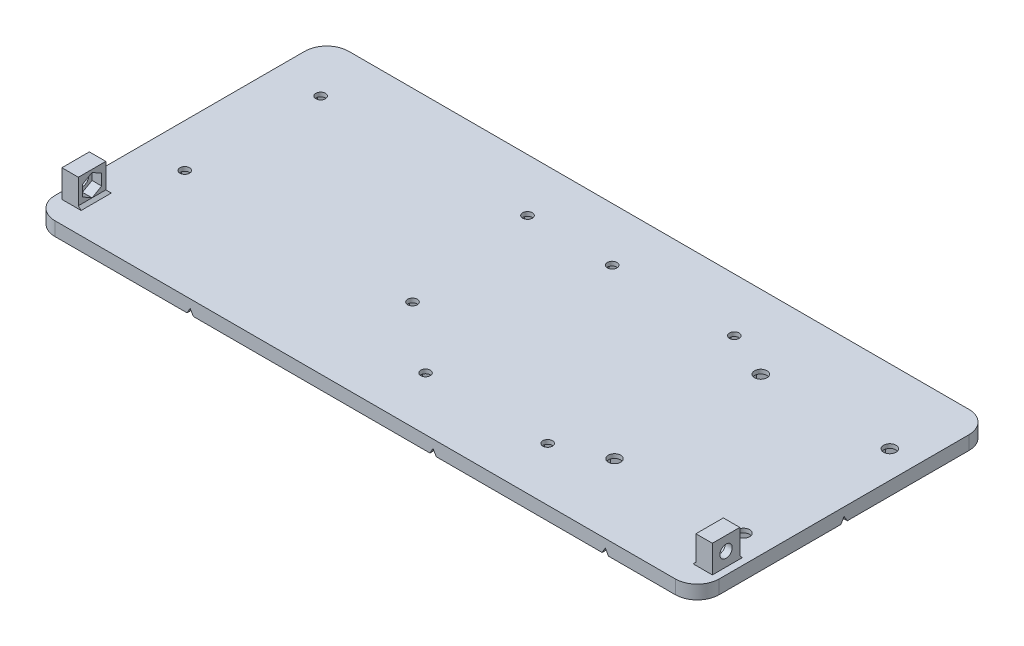
from build123d import *

# Parameters (mm, degrees)
SKETCH3_W               = 242.01
SKETCH3_H               = 107
SKETCH3_R               = 1.75
SKETCH3_R_2             = 2.25
BOSS_EXTRUDE3_DEPTH     = 5
CUT_EXTRUDE1_DEPTH      = 3.5
SKETCH7_W               = 10
SKETCH7_H               = 10
SKETCH7_R               = 2.25
BOSS_EXTRUDE4_DEPTH     = 6
CUT_EXTRUDE2_DEPTH      = 3.5
FILLET1_R               = 8
SKETCH9_W               = 29.32110464
SKETCH9_H               = 129.190564079
CUT_EXTRUDE3_DEPTH      = 10
SKETCH10_W              = 10
SKETCH10_H              = 10
SKETCH10_R              = 2.25
BOSS_EXTRUDE5_DEPTH     = 6
CUT_EXTRUDE4_DEPTH      = 3.5
CUT_EXTRUDE5_DEPTH      = 188.925883263
CUT_EXTRUDE5_DEPTH_BACK = 188.925883263
CUT_EXTRUDE6_DEPTH      = 249.306443936
CUT_EXTRUDE6_DEPTH_BACK = 249.306443936
CHAMFER1_SIZE           = 1


with BuildPart() as part:
    # Sketch3 → Boss-Extrude3 (new body)
    with BuildSketch(Plane(origin=(0, 0, 0), x_dir=(1, 0, 0), z_dir=(0, 1, 0))):
        with Locations((32.755, 0)):
            Rectangle(SKETCH3_W, SKETCH3_H)
        with Locations(Location((-72.5, -14, 0), (0, 0, 270))):
            Circle(SKETCH3_R, mode=Mode.SUBTRACT)
        with Locations(Location((10.5, -14, 0), (0, 0, 270))):
            Circle(SKETCH3_R, mode=Mode.SUBTRACT)
        with Locations(Location((96.75, -26.655, 0), (0, 0, 270))):
            Circle(SKETCH3_R_2, mode=Mode.SUBTRACT)
        with Locations(Location((96.75, 26.655, 0), (0, 0, 270))):
            Circle(SKETCH3_R_2, mode=Mode.SUBTRACT)
        with Locations(Location((143.76, 26.655, 0), (0, 0, 270))):
            Circle(SKETCH3_R_2, mode=Mode.SUBTRACT)
        with Locations(Location((143.76, -26.655, 0), (0, 0, 270))):
            Circle(SKETCH3_R_2, mode=Mode.SUBTRACT)
        with Locations(Location((35.25, 34, 0), (0, 0, 270))):
            Circle(SKETCH3_R, mode=Mode.SUBTRACT)
        with Locations(Location((79.75, 34, 0), (0, 0, 270))):
            Circle(SKETCH3_R, mode=Mode.SUBTRACT)
        with Locations(Location((35.25, -34, 0), (0, 0, 270))):
            Circle(SKETCH3_R, mode=Mode.SUBTRACT)
        with Locations(Location((79.75, -34, 0), (0, 0, 270))):
            Circle(SKETCH3_R, mode=Mode.SUBTRACT)
        with Locations(Location((-71.23, 34.26, 0), (0, 0, 270))):
            Circle(SKETCH3_R, mode=Mode.SUBTRACT)
        with Locations(Location((4.15, 34.26, 0), (0, 0, 270))):
            Circle(SKETCH3_R, mode=Mode.SUBTRACT)
    extrude(amount=BOSS_EXTRUDE3_DEPTH)

    # Sketch4 → Cut-Extrude1 (cut)
    with BuildSketch(Plane.XZ):
        Polygon((96.75, 30.696451884), (93.25, 28.675725942), (93.25, 24.634274058), (96.75, 22.613548116), (100.25, 24.634274058), (100.25, 28.675725942), align=None)
        Polygon((143.76, 30.696451884), (140.26, 28.675725942), (140.26, 24.634274058), (143.76, 22.613548116), (147.26, 24.634274058), (147.26, 28.675725942), align=None)
        Polygon((96.75, -22.613548116), (93.25, -24.634274058), (93.25, -28.675725942), (96.75, -30.696451884), (100.25, -28.675725942), (100.25, -24.634274058), align=None)
        Polygon((143.76, -30.696451884), (147.26, -28.675725942), (147.26, -24.634274058), (143.76, -22.613548116), (140.26, -24.634274058), (140.26, -28.675725942), align=None)
        Polygon((-72.5, 17.117691454), (-75.2, 15.558845727), (-75.2, 12.441154273), (-72.5, 10.882308546), (-69.8, 12.441154273), (-69.8, 15.558845727), align=None)
        Polygon((10.5, 17.117691454), (7.8, 15.558845727), (7.8, 12.441154273), (10.5, 10.882308546), (13.2, 12.441154273), (13.2, 15.558845727), align=None)
        Polygon((35.25, 37.117691454), (32.55, 35.558845727), (32.55, 32.441154273), (35.25, 30.882308546), (37.95, 32.441154273), (37.95, 35.558845727), align=None)
        Polygon((79.75, 37.117691454), (77.05, 35.558845727), (77.05, 32.441154273), (79.75, 30.882308546), (82.45, 32.441154273), (82.45, 35.558845727), align=None)
        Polygon((79.75, -30.882308546), (77.05, -32.441154273), (77.05, -35.558845727), (79.75, -37.117691454), (82.45, -35.558845727), (82.45, -32.441154273), align=None)
        Polygon((35.25, -30.882308546), (32.55, -32.441154273), (32.55, -35.558845727), (35.25, -37.117691454), (37.95, -35.558845727), (37.95, -32.441154273), align=None)
        Polygon((-71.23, -31.142308546), (-73.93, -32.701154273), (-73.93, -35.818845727), (-71.23, -37.377691454), (-68.53, -35.818845727), (-68.53, -32.701154273), align=None)
        Polygon((4.15, -31.142308546), (1.45, -32.701154273), (1.45, -35.818845727), (4.15, -37.377691454), (6.85, -35.818845727), (6.85, -32.701154273), align=None)
    extrude(amount=-CUT_EXTRUDE1_DEPTH, mode=Mode.SUBTRACT)

    # Sketch7 → Boss-Extrude4 (add)
    with BuildSketch(Plane.XY.offset(51)):
        with Locations((58, 10)):
            Rectangle(SKETCH7_W, SKETCH7_H)
        with Locations((58, 10)):
            Circle(SKETCH7_R, mode=Mode.SUBTRACT)
    boss_extrude4 = extrude(amount=-BOSS_EXTRUDE4_DEPTH)

    # Sketch8 → Cut-Extrude2 (cut)
    with BuildSketch(Plane(origin=(0, 0, 45), x_dir=(-1, 0, 0), z_dir=(0, 0, -1))):
        Polygon((-58, 14.012584371), (-61.475, 12.006292185), (-61.475, 7.993707815), (-58, 5.987415629), (-54.525, 7.993707815), (-54.525, 12.006292185), align=None)
    cut_extrude2 = extrude(amount=-CUT_EXTRUDE2_DEPTH, mode=Mode.SUBTRACT)

    # Mirror1: Boss-Extrude4, Cut-Extrude2 across plane
    add(boss_extrude4.mirror(Plane.XY))
    add(cut_extrude2.mirror(Plane.XY), mode=Mode.SUBTRACT)

    # Fillet1
    fillet1_edges = [part.edges().sort_by_distance(p)[0] for p in [
        (-88.25, 2.5, 53.5),
        (-88.25, 2.5, -53.5),
        (153.76, 2.5, -53.5),
        (153.76, 2.5, 53.5),
    ]]
    fillet(fillet1_edges, radius=FILLET1_R)

    # Sketch9 → Cut-Extrude3 (cut)
    with BuildSketch(Plane(origin=(0, 5, 0), x_dir=(1, 0, 0), z_dir=(0, 1, 0))):
        with Locations((53.635180577, -6.372276825)):
            Rectangle(SKETCH9_W, SKETCH9_H)
    extrude(amount=CUT_EXTRUDE3_DEPTH, mode=Mode.SUBTRACT)

    # Sketch10 → Boss-Extrude5 (add)
    with BuildSketch(Plane(origin=(151.26, 0, 0), x_dir=(0, 0, -1), z_dir=(1, 0, 0))):
        with Locations((-40.5, 10)):
            Rectangle(SKETCH10_W, SKETCH10_H)
        with Locations((-40.5, 10)):
            Circle(SKETCH10_R, mode=Mode.SUBTRACT)
    boss_extrude5 = extrude(amount=-BOSS_EXTRUDE5_DEPTH)

    # Sketch11 → Cut-Extrude4 (cut)
    with BuildSketch(Plane.ZY.offset(-145.26)):
        Polygon((40.5, 14.012584371), (37.025, 12.006292185), (37.025, 7.993707815), (40.5, 5.987415629), (43.975, 7.993707815), (43.975, 12.006292185), align=None)
    cut_extrude4 = extrude(amount=-CUT_EXTRUDE4_DEPTH, mode=Mode.SUBTRACT)

    # Mirror2: Boss-Extrude5, Cut-Extrude4 across plane
    add(boss_extrude5.mirror(Plane(origin=(32.755, 0, 0), x_dir=(0, 0, 1), z_dir=(1, 0, 0))))
    add(cut_extrude4.mirror(Plane(origin=(32.755, 0, 0), x_dir=(0, 0, 1), z_dir=(1, 0, 0))), mode=Mode.SUBTRACT)

    # Sketch13 → Cut-Extrude5 (cut, two sides: drawn at the far end of the back side and taken through both)
    with BuildSketch(Plane.XY.offset(53.5).offset(-CUT_EXTRUDE5_DEPTH_BACK)):
        Polygon((-32.154700538, 0), (-31, 2), (-29.845299462, 0), align=None)
        Polygon((56.345299462, 0), (58.654700538, 0), (57.5, 2), align=None)
        Polygon((119.100299462, 0), (120.255, 2), (121.409700538, 0), align=None)
    extrude(amount=CUT_EXTRUDE5_DEPTH + CUT_EXTRUDE5_DEPTH_BACK, mode=Mode.SUBTRACT)

    # Sketch14 → Cut-Extrude6 (cut, two sides: drawn at the far end of the back side and taken through both)
    with BuildSketch(Plane.ZY.offset(88.25).offset(-CUT_EXTRUDE6_DEPTH_BACK)):
        Polygon((-1.154700538, 0), (1.154700538, 0), (0, 2), align=None)
    extrude(amount=CUT_EXTRUDE6_DEPTH + CUT_EXTRUDE6_DEPTH_BACK, mode=Mode.SUBTRACT)

    # Chamfer1
    # the kernel refuses this chamfer: 1 mm, written as the material it adds along each edge
    with BuildSketch(Plane(origin=(145.26, 5, 35.5), x_dir=(-0.9996219169112968, -0.027495876610586605, 0), z_dir=(0, 0, 1))) as chamfer1_piece_1_section:
        Polygon((CHAMFER1_SIZE * 0.999621916911, -CHAMFER1_SIZE * 0.0274958766106), (-CHAMFER1_SIZE * 0.0274958766106, -CHAMFER1_SIZE * 0.999621916911), (0, 0), align=None)
    chamfer1_piece_1 = extrude(amount=10, mode=Mode.PRIVATE)
    chamfer1_piece_1 = split(chamfer1_piece_1, bisect_by=Plane(origin=(144.945420732, 7.148640324, 38.488699829), z_dir=(0, -0.8660254037844382, -0.5000000000000009)), keep=Keep.TOP, mode=Mode.PRIVATE)
    chamfer1_piece_1 = split(chamfer1_piece_1, bisect_by=Plane(origin=(144.945420732, 4.51160926, 37.943828386), z_dir=(0, 0.8660254037844392, -0.4999999999999993)), keep=Keep.TOP, mode=Mode.PRIVATE)
    add(chamfer1_piece_1)
    with BuildSketch(Plane(origin=(145.26, 5, 35.5), x_dir=(-0.9996219169112968, -0.027495876610586605, 0), z_dir=(0, 0, 1))) as chamfer1_piece_2_section:
        Polygon((CHAMFER1_SIZE * 0.999621916911, -CHAMFER1_SIZE * 0.0274958766106), (-CHAMFER1_SIZE * 0.0274958766106, -CHAMFER1_SIZE * 0.999621916911), (0, 0), align=None)
    chamfer1_piece_2 = extrude(amount=10, mode=Mode.PRIVATE)
    chamfer1_piece_2 = split(chamfer1_piece_2, bisect_by=Plane(origin=(144.878613731, 5.798883763, 40.826546771), z_dir=(0, -0.8660254037844382, -0.5000000000000009)), keep=Keep.TOP, mode=Mode.PRIVATE)
    chamfer1_piece_2 = split(chamfer1_piece_2, bisect_by=Plane(origin=(144.878613731, 5.798883763, 40.173453229), z_dir=(0, -0.8660254037844392, 0.4999999999999993)), keep=Keep.TOP, mode=Mode.PRIVATE)
    add(chamfer1_piece_2)
    with BuildSketch(Plane(origin=(145.26, 5, 35.5), x_dir=(-0.9996219169112968, -0.027495876610586605, 0), z_dir=(0, 0, 1))) as chamfer1_piece_3_section:
        Polygon((CHAMFER1_SIZE * 0.999621916911, -CHAMFER1_SIZE * 0.0274958766106), (-CHAMFER1_SIZE * 0.0274958766106, -CHAMFER1_SIZE * 0.999621916911), (0, 0), align=None)
    chamfer1_piece_3 = extrude(amount=10, mode=Mode.PRIVATE)
    chamfer1_piece_3 = split(chamfer1_piece_3, bisect_by=Plane(origin=(144.945420732, 4.51160926, 43.056171614), z_dir=(0, 0.8660254037844382, 0.5000000000000009)), keep=Keep.TOP, mode=Mode.PRIVATE)
    chamfer1_piece_3 = split(chamfer1_piece_3, bisect_by=Plane(origin=(144.945420732, 7.148640324, 42.511300171), z_dir=(0, -0.8660254037844392, 0.4999999999999993)), keep=Keep.TOP, mode=Mode.PRIVATE)
    add(chamfer1_piece_3)
    with BuildSketch(Plane(origin=(151.26, 5, 35.5), x_dir=(0, -0.027495876610586414, -0.9996219169112968), z_dir=(-1, 0, 0))) as chamfer1_piece_4:
        Polygon((CHAMFER1_SIZE * 0.999621916911, -CHAMFER1_SIZE * 0.0274958766106), (-CHAMFER1_SIZE * 0.0274958766106, -CHAMFER1_SIZE * 0.999621916911), (0, 0), align=None)
    extrude(amount=6)
    with BuildSketch(Plane(origin=(-79.75, 5, 35.5), x_dir=(0.9996219169112968, -0.027495876610586605, 0), z_dir=(0, 0, 1))) as chamfer1_piece_5_section:
        Polygon((CHAMFER1_SIZE * 0.999621916911, CHAMFER1_SIZE * 0.0274958766106), (-CHAMFER1_SIZE * 0.0274958766106, CHAMFER1_SIZE * 0.999621916911), (0, 0), align=None)
    chamfer1_piece_5 = extrude(amount=10, mode=Mode.PRIVATE)
    chamfer1_piece_5 = split(chamfer1_piece_5, bisect_by=Plane(origin=(-79.435420732, 7.148640324, 38.488699829), z_dir=(0, -0.8660254037844382, -0.5000000000000009)), keep=Keep.TOP, mode=Mode.PRIVATE)
    chamfer1_piece_5 = split(chamfer1_piece_5, bisect_by=Plane(origin=(-79.435420732, 4.51160926, 37.943828386), z_dir=(0, 0.8660254037844392, -0.4999999999999993)), keep=Keep.TOP, mode=Mode.PRIVATE)
    add(chamfer1_piece_5)
    with BuildSketch(Plane(origin=(-79.75, 5, 35.5), x_dir=(0.9996219169112968, -0.027495876610586605, 0), z_dir=(0, 0, 1))) as chamfer1_piece_6_section:
        Polygon((CHAMFER1_SIZE * 0.999621916911, CHAMFER1_SIZE * 0.0274958766106), (-CHAMFER1_SIZE * 0.0274958766106, CHAMFER1_SIZE * 0.999621916911), (0, 0), align=None)
    chamfer1_piece_6 = extrude(amount=10, mode=Mode.PRIVATE)
    chamfer1_piece_6 = split(chamfer1_piece_6, bisect_by=Plane(origin=(-79.368613731, 5.798883763, 40.826546771), z_dir=(0, -0.8660254037844382, -0.5000000000000009)), keep=Keep.TOP, mode=Mode.PRIVATE)
    chamfer1_piece_6 = split(chamfer1_piece_6, bisect_by=Plane(origin=(-79.368613731, 5.798883763, 40.173453229), z_dir=(0, -0.8660254037844392, 0.4999999999999993)), keep=Keep.TOP, mode=Mode.PRIVATE)
    add(chamfer1_piece_6)
    with BuildSketch(Plane(origin=(-79.75, 5, 35.5), x_dir=(0.9996219169112968, -0.027495876610586605, 0), z_dir=(0, 0, 1))) as chamfer1_piece_7_section:
        Polygon((CHAMFER1_SIZE * 0.999621916911, CHAMFER1_SIZE * 0.0274958766106), (-CHAMFER1_SIZE * 0.0274958766106, CHAMFER1_SIZE * 0.999621916911), (0, 0), align=None)
    chamfer1_piece_7 = extrude(amount=10, mode=Mode.PRIVATE)
    chamfer1_piece_7 = split(chamfer1_piece_7, bisect_by=Plane(origin=(-79.435420732, 4.51160926, 43.056171614), z_dir=(0, 0.8660254037844382, 0.5000000000000009)), keep=Keep.TOP, mode=Mode.PRIVATE)
    chamfer1_piece_7 = split(chamfer1_piece_7, bisect_by=Plane(origin=(-79.435420732, 7.148640324, 42.511300171), z_dir=(0, -0.8660254037844392, 0.4999999999999993)), keep=Keep.TOP, mode=Mode.PRIVATE)
    add(chamfer1_piece_7)
    with BuildSketch(Plane(origin=(-85.75, 5, 35.5), x_dir=(0, -0.027495876610586414, -0.9996219169112968), z_dir=(1, 0, 0))) as chamfer1_piece_8:
        Polygon((CHAMFER1_SIZE * 0.999621916911, CHAMFER1_SIZE * 0.0274958766106), (-CHAMFER1_SIZE * 0.0274958766106, CHAMFER1_SIZE * 0.999621916911), (0, 0), align=None)
    extrude(amount=6)
    with BuildSketch(Plane(origin=(151.26, 5, 35.5), x_dir=(0, -0.027495876610586414, -0.9996219169112968), z_dir=(-1, 0, 0))) as chamfer1_piece_9a_section:
        Polygon((CHAMFER1_SIZE * 0.999621916911, -CHAMFER1_SIZE * 0.0274958766106), (-CHAMFER1_SIZE * 0.0274958766106, -CHAMFER1_SIZE * 0.999621916911), (0, 0), align=None)
    chamfer1_piece_9a = extrude(amount=8.571682988, mode=Mode.PRIVATE)
    chamfer1_piece_9a = split(chamfer1_piece_9a, bisect_by=Plane(origin=(145.26, 5.329793627, 35.170206373), z_dir=(-1, 0, 0)), keep=Keep.TOP, mode=Mode.PRIVATE)
    with BuildSketch(Plane(origin=(145.26, 5, 32.928317012), x_dir=(-0.9996219169112968, -0.027495876610586605, 0), z_dir=(0, 0, 1))) as chamfer1_piece_9b_section:
        Polygon((CHAMFER1_SIZE * 0.999621916911, -CHAMFER1_SIZE * 0.0274958766106), (-CHAMFER1_SIZE * 0.0274958766106, -CHAMFER1_SIZE * 0.999621916911), (0, 0), align=None)
    chamfer1_piece_9b = extrude(amount=12.571682988, mode=Mode.PRIVATE)
    chamfer1_piece_9b = split(chamfer1_piece_9b, bisect_by=Plane(origin=(144.930206373, 5.329793627, 35.5), z_dir=(0, 0, -1)), keep=Keep.TOP, mode=Mode.PRIVATE)
    chamfer1_piece_9 = chamfer1_piece_9a & chamfer1_piece_9b
    add(chamfer1_piece_9)
    with BuildSketch(Plane(origin=(-85.75, 5, 35.5), x_dir=(0, -0.027495876610586414, -0.9996219169112968), z_dir=(1, 0, 0))) as chamfer1_piece_10a_section:
        Polygon((CHAMFER1_SIZE * 0.999621916911, CHAMFER1_SIZE * 0.0274958766106), (-CHAMFER1_SIZE * 0.0274958766106, CHAMFER1_SIZE * 0.999621916911), (0, 0), align=None)
    chamfer1_piece_10a = extrude(amount=8.571682988, mode=Mode.PRIVATE)
    chamfer1_piece_10a = split(chamfer1_piece_10a, bisect_by=Plane(origin=(-79.75, 5.329793627, 35.170206373), z_dir=(1, 0, 0)), keep=Keep.TOP, mode=Mode.PRIVATE)
    with BuildSketch(Plane(origin=(-79.75, 5, 32.928317012), x_dir=(0.9996219169112968, -0.027495876610586605, 0), z_dir=(0, 0, 1))) as chamfer1_piece_10b_section:
        Polygon((CHAMFER1_SIZE * 0.999621916911, CHAMFER1_SIZE * 0.0274958766106), (-CHAMFER1_SIZE * 0.0274958766106, CHAMFER1_SIZE * 0.999621916911), (0, 0), align=None)
    chamfer1_piece_10b = extrude(amount=12.571682988, mode=Mode.PRIVATE)
    chamfer1_piece_10b = split(chamfer1_piece_10b, bisect_by=Plane(origin=(-79.420206373, 5.329793627, 35.5), z_dir=(0, 0, -1)), keep=Keep.TOP, mode=Mode.PRIVATE)
    chamfer1_piece_10 = chamfer1_piece_10a & chamfer1_piece_10b
    add(chamfer1_piece_10)


solid = part.part
